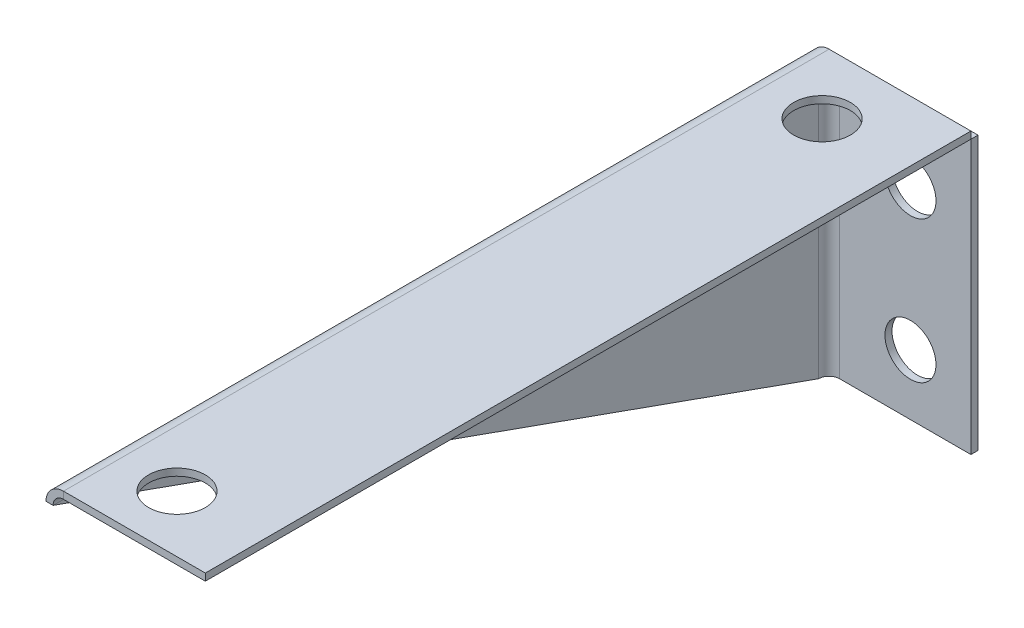
from build123d import *

# Parameters (mm, degrees)
SKETCH1_W          = 10
SKETCH1_H          = 54
BASE_FLANGE1_DEPTH = 0.5
EDGE_FLANGE1_DEPTH = 54
CUT_EXTRUDE1_DEPTH = 10
EDGE_FLANGE2_DEPTH = 19.2634
SKETCH11_R         = 1.8
CUT_EXTRUDE2_DEPTH = 10
SKETCH12_R         = 2
CUT_EXTRUDE3_DEPTH = 10


# Sheet-metal steps are written as plain solids
with BuildPart() as part:
    # Sketch1 → Base-Flange1 (new body)
    with BuildSketch(Plane(origin=(0, 0, 0), x_dir=(1, 0, 0), z_dir=(0, 1, 0))):
        with Locations((-31.456172324, -6.536484397)):
            Rectangle(SKETCH1_W, SKETCH1_H)
    extrude(amount=-BASE_FLANGE1_DEPTH)

    # Edge-Flange1 section (across the edge) → Edge-Flange1 (add)
    with BuildSketch(Plane(origin=(-37.192772324, -0.5, 33.536484397), x_dir=(1, 0, 0), z_dir=(0, 0, -1))):
        with BuildLine():
            Line((-0.5, 0.7366), (-0.5, 20))
            Line((-0.5, 20), (0, 20))
            Line((0, 20), (0, 0.7366))
            ThreePointArc((0, 0.7366), (0.215745145, 0.215745145), (0.7366, 0))
            Line((0.7366, 0), (0.7366, -0.5))
            ThreePointArc((0.7366, -0.5), (-0.137808246, -0.137808246), (-0.5, 0.7366))
        make_face()
    extrude(amount=EDGE_FLANGE1_DEPTH)

    # Sketch7 → Cut-Extrude1 (cut)
    with BuildSketch(Plane.ZY.offset(37.692772324)):
        Polygon((-20.463515603, -20.5), (33.536484397, -1.2366), (33.536484397, -20.5), align=None)
    extrude(amount=-CUT_EXTRUDE1_DEPTH, mode=Mode.SUBTRACT)

    # Edge-Flange2 section (across the edge) → Edge-Flange2 (add)
    with BuildSketch(Plane(origin=(-37.192772324, -20.5, -21.200115603), x_dir=(0, 0, 1), z_dir=(0, 1, 0))):
        with BuildLine():
            Line((-0.5, 0.7366), (-0.5, 10))
            Line((-0.5, 10), (0, 10))
            Line((0, 10), (0, 0.7366))
            ThreePointArc((0, 0.7366), (0.215745145, 0.215745145), (0.7366, 0))
            Line((0.7366, 0), (0.7366, -0.5))
            ThreePointArc((0.7366, -0.5), (-0.137808246, -0.137808246), (-0.5, 0.7366))
        make_face()
    extrude(amount=EDGE_FLANGE2_DEPTH)

    # Sketch11 → Cut-Extrude2 (cut)
    with BuildSketch(Plane(origin=(0, 0, -21.700115603), x_dir=(-1, 0, 0), z_dir=(0, 0, -1))):
        with Locations((31.456172324, -6.2366)):
            Circle(SKETCH11_R)
        with Locations((31.456172324, -16.2366)):
            Circle(SKETCH11_R)
    extrude(amount=-CUT_EXTRUDE2_DEPTH, mode=Mode.SUBTRACT)

    # Sketch12 → Cut-Extrude3 (cut)
    with BuildSketch(Plane(origin=(0, 0, 0), x_dir=(1, 0, 0), z_dir=(0, 1, 0))):
        with Locations(Location((-32.456172324, -29.536484397, 0), (0, 0, 270))):
            Circle(SKETCH12_R)
        with Locations(Location((-32.456172324, 15.963515603, 0), (0, 0, 270))):
            Circle(SKETCH12_R)
    extrude(amount=-CUT_EXTRUDE3_DEPTH, mode=Mode.SUBTRACT)


solid = part.part
